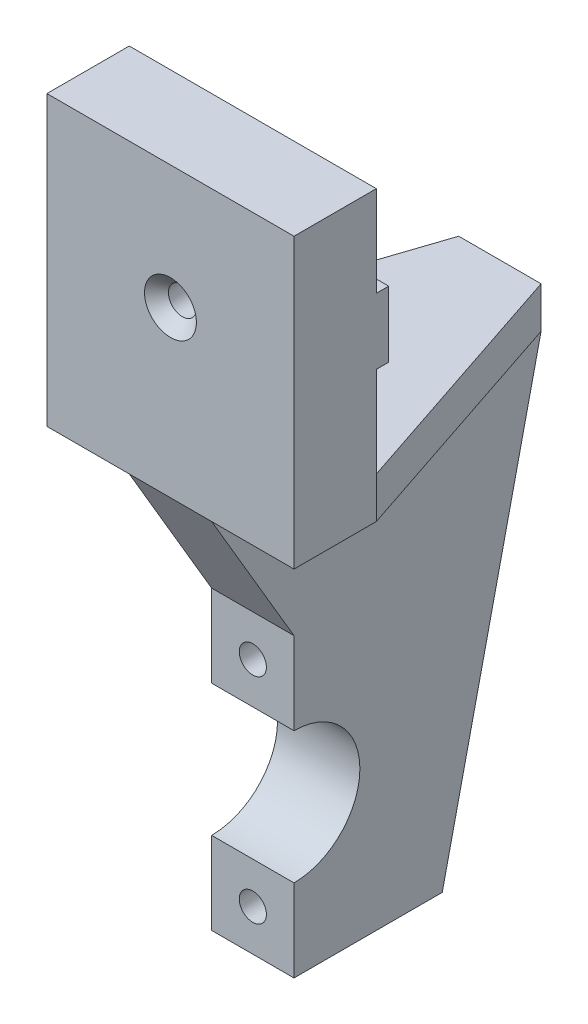
from build123d import *

# Parameters (mm, degrees)
SKETCH_1_W      = 30
SKETCH_1_H      = 30
EXTRUDE_1_DEPTH = 10
EXTRUDE_2_DEPTH = 5
EXTRUDE_3_DEPTH = 5
SKETCH_6_W      = 5
SKETCH_6_H      = 8
EXTRUDE_4_DEPTH = 1.5


# Read off the part's stored shape, not the designer's step: 高级异型孔1, 高级异型孔2
with BuildPart() as part:
    # 草图1 → 凸台-拉伸1 (new body)
    with BuildSketch(Plane.XY):
        with Locations((15, 15)):
            Rectangle(SKETCH_1_W, SKETCH_1_H)
    extrude(amount=EXTRUDE_1_DEPTH)

    # 草图2 → 凸台-拉伸2 (add)
    with BuildSketch(Plane.XZ):
        Polygon((0, 10), (30, 10), (30, 0), (20, -30), (10, -30), (0, 0), align=None)
    extrude(amount=EXTRUDE_2_DEPTH)

    # 草图3 → 凸台-拉伸3 (add, symmetric)
    with BuildSketch(Plane(origin=(15, 0, 0), x_dir=(0, 0, -1), z_dir=(1, 0, 0))):
        with BuildLine():
            Line((0, -48), (0, -58))
            Line((0, -58), (18, -58))
            Line((18, -58), (30, -5))
            Line((30, -5), (-10, -5))
            Line((-10, -5), (0, -22))
            Line((0, -22), (0, -32))
            ThreePointArc((0, -32), (8, -40), (0, -48))
        make_face()
    extrude(amount=EXTRUDE_3_DEPTH, both=True)

    # 草图6 → 凸台-拉伸4 (add, symmetric)
    with BuildSketch(Plane(origin=(0, 0, 0), x_dir=(-1, 0, 0), z_dir=(0, 0, -1))):
        with Locations((-27.5, 15)):
            Rectangle(SKETCH_6_W, SKETCH_6_H)
        with Locations((-2.5, 15)):
            Rectangle(SKETCH_6_W, SKETCH_6_H)
    extrude(amount=EXTRUDE_4_DEPTH, both=True)

    # 高级异型孔1 outline → 高级异型孔1 (revolve, cut)
    with BuildSketch(Plane(origin=(15, 15, 0), x_dir=(1, 0, 0), z_dir=(0, -1, 0))):
        Polygon((3.15, 10), (0, 10), (0, 0), (1.7, 0), (1.7, 8.55), align=None)
    revolve(axis=Axis((15, 15, 0), (0, 0, 1)), mode=Mode.SUBTRACT)

    # 高级异型孔2 outline → 高级异型孔2 (revolve, cut)
    with BuildSketch(Plane(origin=(15, -53, 0), x_dir=(1, 0, 0), z_dir=(0, -1, 0))):
        Polygon((0, -10.991420021), (1.65, -10), (1.65, 0), (0, 0), align=None)
    revolve(axis=Axis((15, -53, 0), (0, 0, 1)), mode=Mode.SUBTRACT)

    # Other 2 2 outline → Other 2 2 (revolve, cut)
    with BuildSketch(Plane(origin=(15, -27, 0), x_dir=(1, 0, 0), z_dir=(0, -1, 0))):
        Polygon((0, -10.991420021), (1.65, -10), (1.65, 0), (0, 0), align=None)
    revolve(axis=Axis((15, -27, 0), (0, 0, 1)), mode=Mode.SUBTRACT)


solid = part.part
